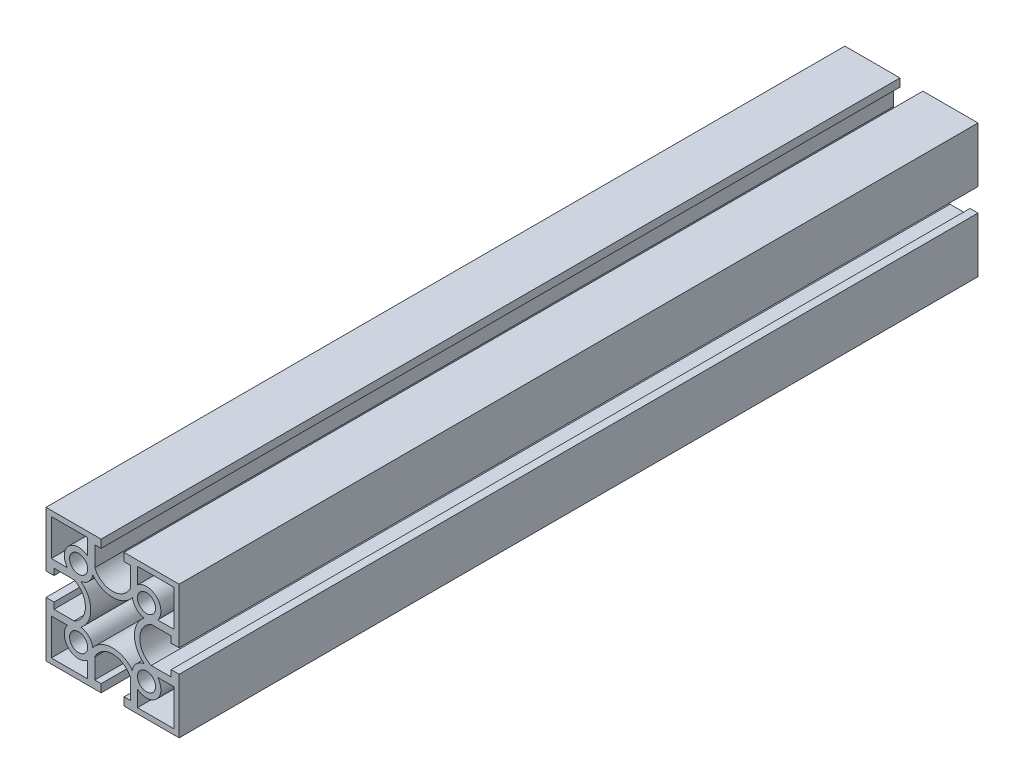
from build123d import *

# Parameters (mm, degrees)
SKETCH_1_R         = 3.4
EXTRUDE_1268_DEPTH = 150


with BuildPart() as part:
    # 草圖1 → Extrude 1268 (new, symmetric)
    with BuildSketch(Plane.XY):
        with BuildLine():
            Line((4.3, 25), (25, 25))
            Line((25, 25), (25, 4.3))
            Line((25, 4.3), (22, 4.3))
            Line((22, 4.3), (22, 6.687301399))
            Line((22, 6.687301399), (14.5, 6.687301399))
            ThreePointArc((14.5, 6.687301399), (10.2, 0), (14.5, -6.687301399))
            Line((14.5, -6.687301399), (22, -6.687301399))
            Line((22, -6.687301399), (22, -4.3))
            Line((22, -4.3), (25, -4.3))
            Line((25, -4.3), (25, -25))
            Line((25, -25), (4.3, -25))
            Line((4.3, -25), (4.3, -22))
            Line((4.3, -22), (6.687301399, -22))
            Line((6.687301399, -22), (6.687301399, -14.5))
            ThreePointArc((6.687301399, -14.5), (0, -10.2), (-6.687301399, -14.5))
            Line((-6.687301399, -14.5), (-6.687301399, -22))
            Line((-6.687301399, -22), (-4.3, -22))
            Line((-4.3, -22), (-4.3, -25))
            Line((-4.3, -25), (-25, -25))
            Line((-25, -25), (-25, -4.3))
            Line((-25, -4.3), (-22, -4.3))
            Line((-22, -4.3), (-22, -6.687301399))
            Line((-22, -6.687301399), (-14.5, -6.687301399))
            ThreePointArc((-14.5, -6.687301399), (-10.2, 0), (-14.5, 6.687301399))
            Line((-14.5, 6.687301399), (-22, 6.687301399))
            Line((-22, 6.687301399), (-22, 4.3))
            Line((-22, 4.3), (-25, 4.3))
            Line((-25, 4.3), (-25, 25))
            Line((-25, 25), (-4.3, 25))
            Line((-4.3, 25), (-4.3, 22))
            Line((-4.3, 22), (-6.687301399, 22))
            Line((-6.687301399, 22), (-6.687301399, 14.5))
            ThreePointArc((-6.687301399, 14.5), (0, 10.2), (6.687301399, 14.5))
            Line((6.687301399, 14.5), (6.687301399, 22))
            Line((6.687301399, 22), (4.3, 22))
            Line((4.3, 22), (4.3, 25))
        make_face()
        with Locations((12.75, 12.75)):
            Circle(SKETCH_1_R, mode=Mode.SUBTRACT)
        with Locations((12.75, -12.75)):
            Circle(SKETCH_1_R, mode=Mode.SUBTRACT)
        with Locations((-12.75, -12.75)):
            Circle(SKETCH_1_R, mode=Mode.SUBTRACT)
        with Locations((-12.75, 12.75)):
            Circle(SKETCH_1_R, mode=Mode.SUBTRACT)
        with BuildLine():
            Line((9.35, 23), (23, 23))
            Line((23, 23), (23, 9.35))
            Line((23, 9.35), (16.945235393, 9.35))
            ThreePointArc((16.945235393, 9.35), (16.568376618, 16.568376618), (9.35, 16.945235393))
            Line((9.35, 16.945235393), (9.35, 23))
        make_face(mode=Mode.SUBTRACT)
        with BuildLine():
            Line((9.35, -23), (9.35, -16.945235393))
            ThreePointArc((9.35, -16.945235393), (16.568376618, -16.568376618), (16.945235393, -9.35))
            Line((16.945235393, -9.35), (23, -9.35))
            Line((23, -9.35), (23, -23))
            Line((23, -23), (9.35, -23))
        make_face(mode=Mode.SUBTRACT)
        with BuildLine():
            Line((-9.35, -23), (-23, -23))
            Line((-23, -23), (-23, -9.35))
            Line((-23, -9.35), (-16.945235393, -9.35))
            ThreePointArc((-16.945235393, -9.35), (-16.568376618, -16.568376618), (-9.35, -16.945235393))
            Line((-9.35, -16.945235393), (-9.35, -23))
        make_face(mode=Mode.SUBTRACT)
        with BuildLine():
            Line((-9.35, 23), (-9.35, 16.945235393))
            ThreePointArc((-9.35, 16.945235393), (-16.568376618, 16.568376618), (-16.945235393, 9.35))
            Line((-16.945235393, 9.35), (-23, 9.35))
            Line((-23, 9.35), (-23, 23))
            Line((-23, 23), (-9.35, 23))
        make_face(mode=Mode.SUBTRACT)
        with BuildLine():
            ThreePointArc((11.864845961, 7.423040048), (8.2, 0), (11.864845961, -7.423040048))
            ThreePointArc((11.864845961, -7.423040048), (8.931623382, -8.931623382), (7.423040048, -11.864845961))
            ThreePointArc((7.423040048, -11.864845961), (0, -8.2), (-7.423040048, -11.864845961))
            ThreePointArc((-7.423040048, -11.864845961), (-8.931623382, -8.931623382), (-11.864845961, -7.423040048))
            ThreePointArc((-11.864845961, -7.423040048), (-8.2, 0), (-11.864845961, 7.423040048))
            ThreePointArc((-11.864845961, 7.423040048), (-8.931623382, 8.931623382), (-7.423040048, 11.864845961))
            ThreePointArc((-7.423040048, 11.864845961), (0, 8.2), (7.423040048, 11.864845961))
            ThreePointArc((7.423040048, 11.864845961), (8.931623382, 8.931623382), (11.864845961, 7.423040048))
        make_face(mode=Mode.SUBTRACT)
    extrude(amount=EXTRUDE_1268_DEPTH, both=True)


solid = part.part
